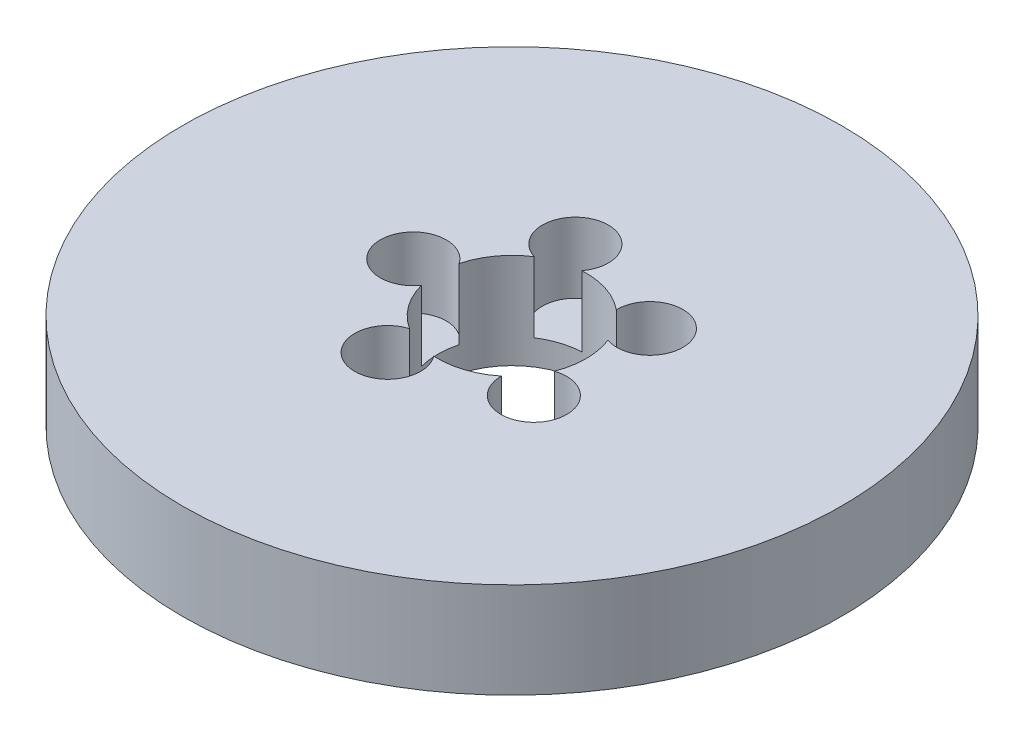
from build123d import *

# Parameters (mm, degrees)
SKETCH1_R           = 100
BOSS_EXTRUDE1_DEPTH = 29
SKETCH2_R           = 22.5
CUT_EXTRUDE1_DEPTH  = 145.364122967
SKETCH3_R           = 10
CUT_EXTRUDE2_DEPTH  = 21.321634438
CIRPATTERN1_COUNT   = 5


with BuildPart() as part:
    # Sketch1 → Boss-Extrude1 (new body)
    with BuildSketch(Plane(origin=(0, 0, 0), x_dir=(1, 0, 0), z_dir=(0, 1, 0))):
        Circle(SKETCH1_R)
    extrude(amount=BOSS_EXTRUDE1_DEPTH)

    # Sketch2 → Cut-Extrude1 (cut, through all)
    with BuildSketch(Plane(origin=(0, 0, 0), x_dir=(1, 0, 0), z_dir=(0, 1, 0))):
        Circle(SKETCH2_R)
    extrude(amount=CUT_EXTRUDE1_DEPTH, mode=Mode.SUBTRACT)

    # Sketch3 → Cut-Extrude2 (cut)
    with BuildSketch(Plane(origin=(0, 29, 0), x_dir=(1, 0, 0), z_dir=(0, 1, 0))):
        with Locations((-29.950494376, 0)):
            Circle(SKETCH3_R)
    cut_extrude2 = extrude(amount=-CUT_EXTRUDE2_DEPTH, mode=Mode.SUBTRACT)

    # CirPattern1: Cut-Extrude2 ×5 about axis
    cirpattern1_axis = Axis((0, 0, 0), (0, 1, 0))
    for i in range(1, CIRPATTERN1_COUNT):
        add(cut_extrude2.rotate(cirpattern1_axis, i * 360 / CIRPATTERN1_COUNT), mode=Mode.SUBTRACT)


solid = part.part
